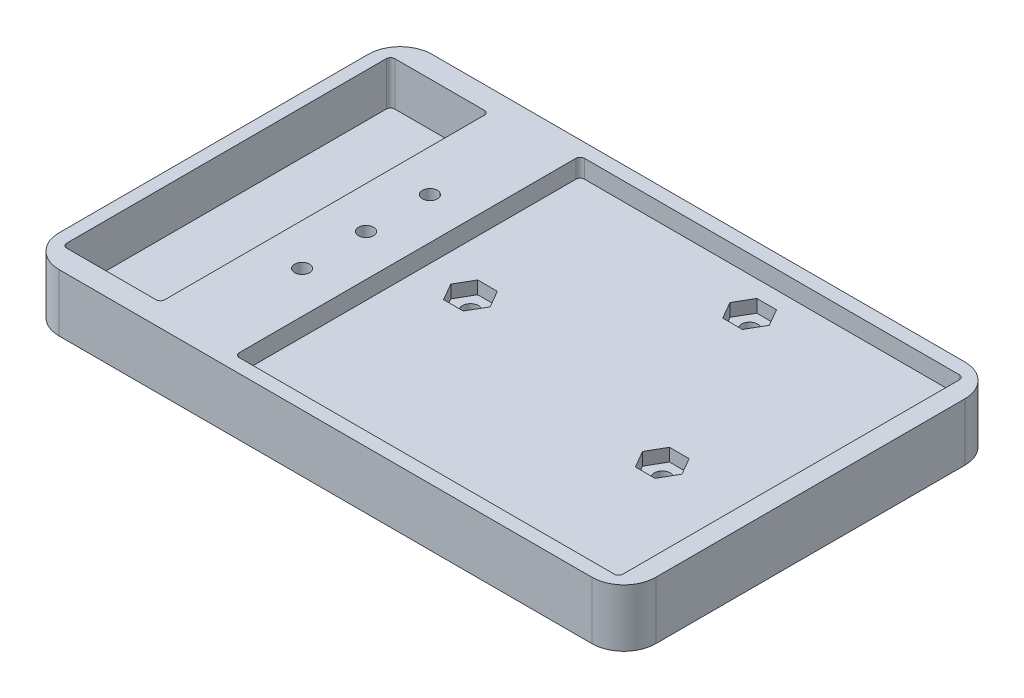
from build123d import *

# Parameters (mm, degrees)
SKETCH1_W             = 140
SKETCH1_H             = 87.5
BOSS_EXTRUDE1_DEPTH   = 13.5
SKETCH2_W             = 90
SKETCH2_H             = 81
CUT_EXTRUDE1_DEPTH    = 4.25
SKETCH5_W             = 23
SKETCH5_H             = 77
CUT_EXTRUDE2_DEPTH    = 10.25
F_6_CLEARANCE_HOLE1_D = 3.7973
CUT_EXTRUDE4_DEPTH    = 3
FILLET1_R             = 7.5
SKETCH15_R            = 1.75
CUT_EXTRUDE3_DEPTH    = 7.5
FILLET2_R             = 1


with BuildPart() as part:
    # Sketch1 → Boss-Extrude1 (new body)
    with BuildSketch(Plane(origin=(0, 0, 0), x_dir=(1, 0, 0), z_dir=(0, 1, 0))):
        with Locations((70, 43.75)):
            Rectangle(SKETCH1_W, SKETCH1_H)
    extrude(amount=BOSS_EXTRUDE1_DEPTH)

    # Sketch2 → Cut-Extrude1 (cut)
    with BuildSketch(Plane(origin=(0, 13.5, 0), x_dir=(1, 0, 0), z_dir=(0, 1, 0))):
        with Locations((90.5, 43.75)):
            Rectangle(SKETCH2_W, SKETCH2_H)
    extrude(amount=-CUT_EXTRUDE1_DEPTH, mode=Mode.SUBTRACT)

    # Sketch5 → Cut-Extrude2 (cut)
    with BuildSketch(Plane(origin=(0, 13.5, 0), x_dir=(1, 0, 0), z_dir=(0, 1, 0))):
        with Locations((14.5, 43.75)):
            Rectangle(SKETCH5_W, SKETCH5_H)
    extrude(amount=-CUT_EXTRUDE2_DEPTH, mode=Mode.SUBTRACT)

    # #6 Clearance Hole1 (through all)
    with Locations(Plane(origin=(0, 9.25, 0), x_dir=(1, 0, 0), z_dir=(0, 1, 0))):
        with Locations((56.75, 47.25), (93.25, 76.25), (113.25, 35.75)):
            Hole(F_6_CLEARANCE_HOLE1_D / 2)

    # Sketch19 → Cut-Extrude4 (cut)
    with BuildSketch(Plane(origin=(0, 9.25, 0), x_dir=(1, 0, 0), z_dir=(0, 1, 0))):
        Polygon((59.059401077, 51.25), (54.440598923, 51.25), (52.131197846, 47.25), (54.440598923, 43.25), (59.059401077, 43.25), (61.368802154, 47.25), align=None)
        Polygon((97.868802154, 76.25), (95.559401077, 80.25), (90.940598923, 80.25), (88.631197846, 76.25), (90.940598923, 72.25), (95.559401077, 72.25), align=None)
        Polygon((117.868802154, 35.75), (115.559401077, 39.75), (110.940598923, 39.75), (108.631197846, 35.75), (110.940598923, 31.75), (115.559401077, 31.75), align=None)
    extrude(amount=-CUT_EXTRUDE4_DEPTH, mode=Mode.SUBTRACT)

    # Fillet1
    fillet1_edges = [part.edges().sort_by_distance(p)[0] for p in [
        (0, 6.75, 0),
        (0, 6.75, -87.5),
        (140, 6.75, -87.5),
        (140, 6.75, 0),
    ]]
    fillet(fillet1_edges, radius=FILLET1_R)

    # Sketch15 → Cut-Extrude3 (cut)
    with BuildSketch(Plane(origin=(0, 13.5, 0), x_dir=(1, 0, 0), z_dir=(0, 1, 0))):
        with Locations((35.75, 43.75)):
            Circle(SKETCH15_R)
        with Locations((35.75, 58.75)):
            Circle(SKETCH15_R)
        with Locations((35.75, 28.75)):
            Circle(SKETCH15_R)
    extrude(amount=-CUT_EXTRUDE3_DEPTH, mode=Mode.SUBTRACT)

    # Fillet2
    fillet2_edges = [part.edges().sort_by_distance(p)[0] for p in [
        (3, 8.375, -5.25),
        (26, 8.375, -5.25),
        (26, 8.375, -82.25),
        (3, 8.375, -82.25),
        (135.5, 11.375, -3.25),
        (45.5, 11.375, -3.25),
        (135.5, 11.375, -84.25),
        (45.5, 11.375, -84.25),
    ]]
    fillet(fillet2_edges, radius=FILLET2_R)


solid = part.part
